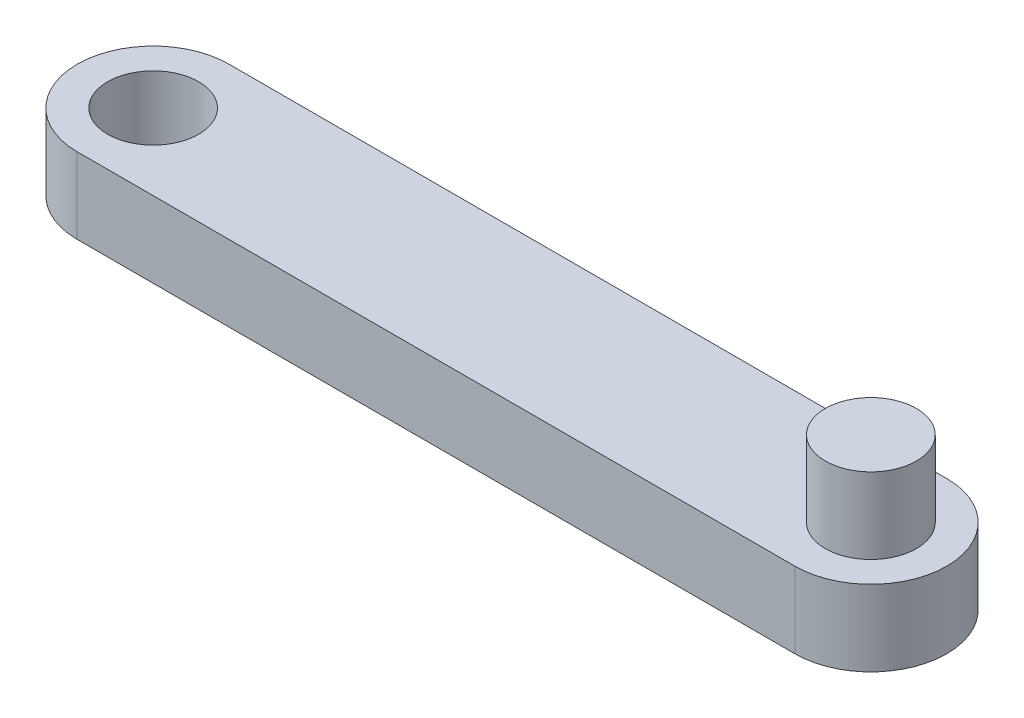
from build123d import *

# Parameters (mm, degrees)
SKETCH_1_R      = 3
EXTRUDE_1_DEPTH = 5
SKETCH_2_R      = 3
EXTRUDE_2_DEPTH = 5


with BuildPart() as part:
    # 草图1 → 凸台-拉伸1 (new body)
    with BuildSketch(Plane(origin=(0, 0, 0), x_dir=(1, 0, 0), z_dir=(0, 1, 0))):
        with BuildLine():
            Line((0, 0), (47.28, 0))
            ThreePointArc((47.28, 0), (52.28, -5), (47.28, -10))
            Line((47.28, -10), (0, -10))
            ThreePointArc((0, -10), (-5, -5), (0, 0))
        make_face()
        with Locations((0, -5)):
            Circle(SKETCH_1_R, mode=Mode.SUBTRACT)
    extrude(amount=EXTRUDE_1_DEPTH)

    # 草图2 → 凸台-拉伸2 (add)
    with BuildSketch(Plane(origin=(0, 5, 0), x_dir=(1, 0, 0), z_dir=(0, 1, 0))):
        with Locations((47.28, -5)):
            Circle(SKETCH_2_R)
    extrude(amount=EXTRUDE_2_DEPTH)


solid = part.part
